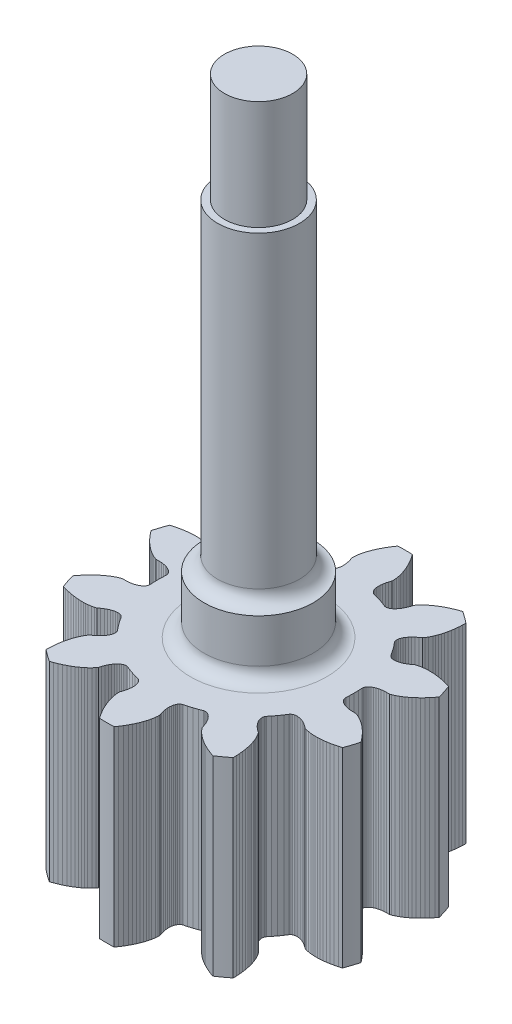
from build123d import *

# Parameters (mm, degrees)
SKETCH1_R           = 2
BOSS_EXTRUDE1_DEPTH = 2.1
SKETCH2_R           = 1.5
BOSS_EXTRUDE3_DEPTH = 15.8
BOSS_EXTRUDE4_DEPTH = 7
FILLET1_R           = 0.5
CUT_EXTRUDE3_START  = -4
SKETCH5_R           = 1.5
SKETCH5_R_2         = 1.25
CUT_EXTRUDE3_DEPTH  = 4


with BuildPart() as part:
    # Sketch1 → Boss-Extrude1 (new body)
    with BuildSketch(Plane(origin=(0, 0, 0), x_dir=(1, 0, 0), z_dir=(0, 1, 0))):
        with Locations(Location((0, 0, 0), (0, 0, 270))):
            Circle(SKETCH1_R)
    extrude(amount=BOSS_EXTRUDE1_DEPTH)

    # Sketch2 → Boss-Extrude3 (add)
    with BuildSketch(Plane(origin=(0, 2.1, 0), x_dir=(1, 0, 0), z_dir=(0, 1, 0))):
        with Locations(Location((0, 0, 0), (0, 0, 270))):
            Circle(SKETCH2_R)
    extrude(amount=BOSS_EXTRUDE3_DEPTH)

    # Sketch4 → Boss-Extrude4 (add)
    with BuildSketch(Plane.XZ):
        with BuildLine():
            Line((-3.502172386, -4.006520446), (-3.489098986, -3.880720446))
            Line((-3.489098986, -3.880720446), (-3.472014986, -3.764268346))
            Line((-3.472014986, -3.764268346), (-3.451540686, -3.656378846))
            Line((-3.451540686, -3.656378846), (-3.428181486, -3.556355946))
            Line((-3.428181486, -3.556355946), (-3.402988686, -3.465729946))
            Line((-3.402988686, -3.465729946), (-3.376065786, -3.382487046))
            Line((-3.376065786, -3.382487046), (-3.348306486, -3.307523846))
            Line((-3.348306486, -3.307523846), (-3.320181886, -3.240379146))
            Line((-3.320181886, -3.240379146), (-3.266407586, -3.131298946))
            Line((-3.266407586, -3.131298946), (-3.218278986, -3.051264446))
            Line((-3.218278986, -3.051264446), (-3.178117286, -2.996127846))
            Line((-3.178117286, -2.996127846), (-3.098559286, -2.941403346))
            Line((-3.098559286, -2.941403346), (-3.022652486, -2.880802746))
            Line((-3.022652486, -2.880802746), (-2.957019886, -2.819348146))
            Line((-2.957019886, -2.819348146), (-2.901592786, -2.757780546))
            Line((-2.901592786, -2.757780546), (-2.856248686, -2.696863946))
            Line((-2.856248686, -2.696863946), (-2.820830686, -2.637324746))
            Line((-2.820830686, -2.637324746), (-2.795113386, -2.579864646))
            Line((-2.795113386, -2.579864646), (-2.778873586, -2.525198846))
            Line((-2.778873586, -2.525198846), (-2.771797686, -2.474014346))
            Line((-2.771797686, -2.474014346), (-2.773561786, -2.426978146))
            Line((-2.773561786, -2.426978146), (-2.783801486, -2.384727846))
            Line((-2.783801486, -2.384727846), (-2.802098086, -2.347873846))
            Line((-2.802098086, -2.347873846), (-2.810946486, -2.335576046))
            Line((-2.810946486, -2.335576046), (-2.897380486, -2.230985746))
            Line((-2.897380486, -2.230985746), (-2.994333386, -2.103581146))
            Line((-2.994333386, -2.103581146), (-3.085542286, -1.972003246))
            Line((-3.085542286, -1.972003246), (-3.158303986, -1.857479346))
            Line((-3.158303986, -1.857479346), (-3.167265586, -1.845263946))
            Line((-3.167265586, -1.845263946), (-3.196661886, -1.816474346))
            Line((-3.196661886, -1.816474346), (-3.233680086, -1.793679646))
            Line((-3.233680086, -1.793679646), (-3.277869086, -1.777466946))
            Line((-3.277869086, -1.777466946), (-3.328734986, -1.768379646))
            Line((-3.328734986, -1.768379646), (-3.385743486, -1.766931946))
            Line((-3.385743486, -1.766931946), (-3.448338486, -1.773634446))
            Line((-3.448338486, -1.773634446), (-3.515908386, -1.788920346))
            Line((-3.515908386, -1.788920346), (-3.587855586, -1.813220846))
            Line((-3.587855586, -1.813220846), (-3.663537786, -1.846909746))
            Line((-3.663537786, -1.846909746), (-3.742266186, -1.890339446))
            Line((-3.742266186, -1.890339446), (-3.823357286, -1.943804546))
            Line((-3.823357286, -1.943804546), (-3.899988086, -2.002557846))
            Line((-3.899988086, -2.002557846), (-3.964836786, -2.023715746))
            Line((-3.964836786, -2.023715746), (-4.055826686, -2.044756746))
            Line((-4.055826686, -2.044756746), (-4.176185286, -2.062191546))
            Line((-4.176185286, -2.062191546), (-4.248734686, -2.068190746))
            Line((-4.248734686, -2.068190746), (-4.328607086, -2.071426546))
            Line((-4.328607086, -2.071426546), (-4.416095286, -2.071308246))
            Line((-4.416095286, -2.071308246), (-4.510070786, -2.067263046))
            Line((-4.510070786, -2.067263046), (-4.612416586, -2.058570246))
            Line((-4.612416586, -2.058570246), (-4.721352586, -2.044702746))
            Line((-4.721352586, -2.044702746), (-4.837384286, -2.024964946))
            Line((-4.837384286, -2.024964946), (-4.961067086, -1.998524146))
            Line((-4.961067086, -1.998524146), (-5.088285486, -1.965702846))
            Line((-5.088285486, -1.965702846), (-5.199859886, -1.932155946))
            ThreePointArc((-5.199859886, -1.932155946), (-5.288876117, -1.679412336), (-5.365419485, -1.422616047))
            Line((-5.365419485, -1.422616047), (-5.29487224, -1.329894231))
            Line((-5.29487224, -1.329894231), (-5.21124224, -1.228564231))
            Line((-5.21124224, -1.228564231), (-5.12672224, -1.134474231))
            Line((-5.12672224, -1.134474231), (-5.04445224, -1.050304231))
            Line((-5.04445224, -1.050304231), (-4.96447224, -0.975054231))
            Line((-4.96447224, -0.975054231), (-4.88678224, -0.907864231))
            Line((-4.88678224, -0.907864231), (-4.81313224, -0.849354231))
            Line((-4.81313224, -0.849354231), (-4.74242224, -0.797834231))
            Line((-4.74242224, -0.797834231), (-4.67590224, -0.753504231))
            Line((-4.67590224, -0.753504231), (-4.61368224, -0.715714231))
            Line((-4.61368224, -0.715714231), (-4.50606224, -0.659074231))
            Line((-4.50606224, -0.659074231), (-4.42008224, -0.622614231))
            Line((-4.42008224, -0.622614231), (-4.35518224, -0.601614231))
            Line((-4.35518224, -0.601614231), (-4.25865224, -0.604104231))
            Line((-4.25865224, -0.604104231), (-4.16162224, -0.599694231))
            Line((-4.16162224, -0.599694231), (-4.07240224, -0.588554231))
            Line((-4.07240224, -0.588554231), (-3.99137224, -0.571324231))
            Line((-3.99137224, -0.571324231), (-3.91888224, -0.548694231))
            Line((-3.91888224, -0.548694231), (-3.85523224, -0.521344231))
            Line((-3.85523224, -0.521344231), (-3.80065224, -0.489974231))
            Line((-3.80065224, -0.489974231), (-3.75538224, -0.455294231))
            Line((-3.75538224, -0.455294231), (-3.71957224, -0.418044231))
            Line((-3.71957224, -0.418044231), (-3.69335224, -0.378954231))
            Line((-3.69335224, -0.378954231), (-3.67680224, -0.338754231))
            Line((-3.67680224, -0.338754231), (-3.66994224, -0.298184231))
            Line((-3.66994224, -0.298184231), (-3.66987224, -0.283034231))
            Line((-3.66987224, -0.283034231), (-3.67832224, -0.147614231))
            Line((-3.67832224, -0.147614231), (-3.68187224, 0.012445769))
            Line((-3.68187224, 0.012445769), (-3.67832224, 0.172505769))
            Line((-3.67832224, 0.172505769), (-3.66987224, 0.307925769))
            Line((-3.66987224, 0.307925769), (-3.66994224, 0.323075769))
            Line((-3.66994224, 0.323075769), (-3.67680224, 0.363645769))
            Line((-3.67680224, 0.363645769), (-3.69335224, 0.403845769))
            Line((-3.69335224, 0.403845769), (-3.71957224, 0.442935769))
            Line((-3.71957224, 0.442935769), (-3.75538224, 0.480185769))
            Line((-3.75538224, 0.480185769), (-3.80065224, 0.514865769))
            Line((-3.80065224, 0.514865769), (-3.85523224, 0.546235769))
            Line((-3.85523224, 0.546235769), (-3.91888224, 0.573585769))
            Line((-3.91888224, 0.573585769), (-3.99137224, 0.596215769))
            Line((-3.99137224, 0.596215769), (-4.07240224, 0.613445769))
            Line((-4.07240224, 0.613445769), (-4.16162224, 0.624585769))
            Line((-4.16162224, 0.624585769), (-4.25865224, 0.628995769))
            Line((-4.25865224, 0.628995769), (-4.35518224, 0.626505769))
            Line((-4.35518224, 0.626505769), (-4.42008224, 0.647505769))
            Line((-4.42008224, 0.647505769), (-4.50606224, 0.683965769))
            Line((-4.50606224, 0.683965769), (-4.61368224, 0.740605769))
            Line((-4.61368224, 0.740605769), (-4.67590224, 0.778395769))
            Line((-4.67590224, 0.778395769), (-4.74242224, 0.822725769))
            Line((-4.74242224, 0.822725769), (-4.81313224, 0.874245769))
            Line((-4.81313224, 0.874245769), (-4.88678224, 0.932755769))
            Line((-4.88678224, 0.932755769), (-4.96447224, 0.999945769))
            Line((-4.96447224, 0.999945769), (-5.04445224, 1.075195769))
            Line((-5.04445224, 1.075195769), (-5.12672224, 1.159365769))
            Line((-5.12672224, 1.159365769), (-5.21124224, 1.253455769))
            Line((-5.21124224, 1.253455769), (-5.29487224, 1.354785769))
            Line((-5.29487224, 1.354785769), (-5.36541934, 1.447507569))
            ThreePointArc((-5.36541934, 1.447507569), (-5.288875971, 1.704303861), (-5.199859739, 1.957047474))
            Line((-5.199859739, 1.957047474), (-5.088285394, 1.990594354))
            Line((-5.088285394, 1.990594354), (-4.961066994, 2.023415654))
            Line((-4.961066994, 2.023415654), (-4.837384194, 2.049856454))
            Line((-4.837384194, 2.049856454), (-4.721352494, 2.069594254))
            Line((-4.721352494, 2.069594254), (-4.612416494, 2.083461754))
            Line((-4.612416494, 2.083461754), (-4.510070694, 2.092154554))
            Line((-4.510070694, 2.092154554), (-4.416095194, 2.096199754))
            Line((-4.416095194, 2.096199754), (-4.328606994, 2.096318054))
            Line((-4.328606994, 2.096318054), (-4.248734594, 2.093082254))
            Line((-4.248734594, 2.093082254), (-4.176185194, 2.087083054))
            Line((-4.176185194, 2.087083054), (-4.055826594, 2.069648254))
            Line((-4.055826594, 2.069648254), (-3.964836694, 2.048607254))
            Line((-3.964836694, 2.048607254), (-3.899987994, 2.027449354))
            Line((-3.899987994, 2.027449354), (-3.823357194, 1.968696054))
            Line((-3.823357194, 1.968696054), (-3.742266094, 1.915230954))
            Line((-3.742266094, 1.915230954), (-3.663537694, 1.871801254))
            Line((-3.663537694, 1.871801254), (-3.587855494, 1.838112354))
            Line((-3.587855494, 1.838112354), (-3.515908294, 1.813811854))
            Line((-3.515908294, 1.813811854), (-3.448338394, 1.798525954))
            Line((-3.448338394, 1.798525954), (-3.385743394, 1.791823454))
            Line((-3.385743394, 1.791823454), (-3.328734894, 1.793271154))
            Line((-3.328734894, 1.793271154), (-3.277868994, 1.802358454))
            Line((-3.277868994, 1.802358454), (-3.233679994, 1.818571154))
            Line((-3.233679994, 1.818571154), (-3.196661794, 1.841365854))
            Line((-3.196661794, 1.841365854), (-3.167265494, 1.870155454))
            Line((-3.167265494, 1.870155454), (-3.158303894, 1.882370854))
            Line((-3.158303894, 1.882370854), (-3.085542194, 1.996894754))
            Line((-3.085542194, 1.996894754), (-2.994333294, 2.128472654))
            Line((-2.994333294, 2.128472654), (-2.897380394, 2.255877254))
            Line((-2.897380394, 2.255877254), (-2.810946394, 2.360467554))
            Line((-2.810946394, 2.360467554), (-2.802097994, 2.372765354))
            Line((-2.802097994, 2.372765354), (-2.783801394, 2.409619354))
            Line((-2.783801394, 2.409619354), (-2.773561694, 2.451869654))
            Line((-2.773561694, 2.451869654), (-2.771797594, 2.498905854))
            Line((-2.771797594, 2.498905854), (-2.778873494, 2.550090354))
            Line((-2.778873494, 2.550090354), (-2.795113294, 2.604756154))
            Line((-2.795113294, 2.604756154), (-2.820830594, 2.662216254))
            Line((-2.820830594, 2.662216254), (-2.856248594, 2.721755454))
            Line((-2.856248594, 2.721755454), (-2.901592694, 2.782672054))
            Line((-2.901592694, 2.782672054), (-2.957019794, 2.844239654))
            Line((-2.957019794, 2.844239654), (-3.022652394, 2.905694254))
            Line((-3.022652394, 2.905694254), (-3.098559194, 2.966294854))
            Line((-3.098559194, 2.966294854), (-3.178117194, 3.021019354))
            Line((-3.178117194, 3.021019354), (-3.218278894, 3.076155954))
            Line((-3.218278894, 3.076155954), (-3.266407494, 3.156190454))
            Line((-3.266407494, 3.156190454), (-3.320181794, 3.265270654))
            Line((-3.320181794, 3.265270654), (-3.348306394, 3.332415354))
            Line((-3.348306394, 3.332415354), (-3.376065694, 3.407378554))
            Line((-3.376065694, 3.407378554), (-3.402988594, 3.490621454))
            Line((-3.402988594, 3.490621454), (-3.428181394, 3.581247454))
            Line((-3.428181394, 3.581247454), (-3.451540594, 3.681270354))
            Line((-3.451540594, 3.681270354), (-3.472014894, 3.789159854))
            Line((-3.472014894, 3.789159854), (-3.489098894, 3.905611954))
            Line((-3.489098894, 3.905611954), (-3.502172294, 4.031411954))
            Line((-3.502172294, 4.031411954), (-3.510270094, 4.162546154))
            Line((-3.510270094, 4.162546154), (-3.512843394, 4.279026254))
            ThreePointArc((-3.512843394, 4.279026254), (-3.299977421, 4.441787778), (-3.079402794, 4.593939248))
            Line((-3.079402794, 4.593939248), (-2.969419, 4.555497462))
            Line((-2.969419, 4.555497462), (-2.8472053, 4.507273362))
            Line((-2.8472053, 4.507273362), (-2.7316023, 4.455965462))
            Line((-2.7316023, 4.455965462), (-2.626129, 4.403731962))
            Line((-2.626129, 4.403731962), (-2.5298468, 4.350920062))
            Line((-2.5298468, 4.350920062), (-2.4419378, 4.297795262))
            Line((-2.4419378, 4.297795262), (-2.3635324, 4.245830562))
            Line((-2.3635324, 4.245830562), (-2.2926834, 4.194501962))
            Line((-2.2926834, 4.194501962), (-2.2299672, 4.144936362))
            Line((-2.2299672, 4.144936362), (-2.1747998, 4.097439362))
            Line((-2.1747998, 4.097439362), (-2.0876755, 4.012589362))
            Line((-2.0876755, 4.012589362), (-2.0264307, 3.942084362))
            Line((-2.0264307, 3.942084362), (-1.9864033, 3.886850062))
            Line((-1.9864033, 3.886850062), (-1.9589421, 3.794275162))
            Line((-1.9589421, 3.794275162), (-1.924764, 3.703356962))
            Line((-1.924764, 3.703356962), (-1.8865987, 3.621946062))
            Line((-1.8865987, 3.621946062), (-1.8451724, 3.550206362))
            Line((-1.8451724, 3.550206362), (-1.8012493, 3.488257362))
            Line((-1.8012493, 3.488257362), (-1.755569, 3.436174162))
            Line((-1.755569, 3.436174162), (-1.7088682, 3.393959362))
            Line((-1.7088682, 3.393959362), (-1.6618964, 3.361621762))
            Line((-1.6618964, 3.361621762), (-1.6154036, 3.339075362))
            Line((-1.6154036, 3.339075362), (-1.5701244, 3.326218062))
            Line((-1.5701244, 3.326218062), (-1.5267777, 3.322900562))
            Line((-1.5267777, 3.322900562), (-1.4860735, 3.328913162))
            Line((-1.4860735, 3.328913162), (-1.4716433, 3.333528162))
            Line((-1.4716433, 3.333528162), (-1.3454624, 3.383411662))
            Line((-1.3454624, 3.383411662), (-1.1943333, 3.436249262))
            Line((-1.1943333, 3.436249262), (-1.0410102, 3.482334262))
            Line((-1.0410102, 3.482334262), (-0.909607, 3.516144862))
            Line((-0.909607, 3.516144862), (-0.8952201, 3.520893062))
            Line((-0.8952201, 3.520893062), (-0.8587556, 3.539954162))
            Line((-0.8587556, 3.539954162), (-0.8256373, 3.568116562))
            Line((-0.8256373, 3.568116562), (-0.796563, 3.605132762))
            Line((-0.796563, 3.605132762), (-0.772202, 3.650700962))
            Line((-0.772202, 3.650700962), (-0.7532086, 3.704472062))
            Line((-0.7532086, 3.704472062), (-0.7402401, 3.766074562))
            Line((-0.7402401, 3.766074562), (-0.7338976, 3.835060962))
            Line((-0.7338976, 3.835060962), (-0.7347758, 3.910996062))
            Line((-0.7347758, 3.910996062), (-0.7434288, 3.993384562))
            Line((-0.7434288, 3.993384562), (-0.7604045, 4.081680262))
            Line((-0.7604045, 4.081680262), (-0.7861943, 4.175324062))
            Line((-0.7861943, 4.175324062), (-0.8183918, 4.266360062))
            Line((-0.8183918, 4.266360062), (-0.8184748, 4.334572962))
            Line((-0.8184748, 4.334572962), (-0.8103686, 4.427611562))
            Line((-0.8103686, 4.427611562), (-0.7897572, 4.547466962))
            Line((-0.7897572, 4.547466962), (-0.7730438, 4.618319462))
            Line((-0.7730438, 4.618319462), (-0.7514392, 4.695282462))
            Line((-0.7514392, 4.695282462), (-0.7242914, 4.778452262))
            Line((-0.7242914, 4.778452262), (-0.6914042, 4.866578162))
            Line((-0.6914042, 4.866578162), (-0.6515102, 4.961228562))
            Line((-0.6515102, 4.961228562), (-0.6046584, 5.060547662))
            Line((-0.6046584, 5.060547662), (-0.5500308, 5.164800962))
            Line((-0.5500308, 5.164800962), (-0.486664, 5.274259662))
            Line((-0.486664, 5.274259662), (-0.4161366, 5.385109262))
            Line((-0.4161366, 5.385109262), (-0.3497532, 5.480856162))
            ThreePointArc((-0.3497532, 5.480856162), (-0.081872201, 5.487413535), (0.186008797, 5.480856162))
            Line((0.186008797, 5.480856162), (0.2523922, 5.385109235))
            Line((0.2523922, 5.385109235), (0.3229197, 5.274259635))
            Line((0.3229197, 5.274259635), (0.3862865, 5.164800935))
            Line((0.3862865, 5.164800935), (0.4409141, 5.060547635))
            Line((0.4409141, 5.060547635), (0.4877659, 4.961228535))
            Line((0.4877659, 4.961228535), (0.5276599, 4.866578135))
            Line((0.5276599, 4.866578135), (0.5605471, 4.778452235))
            Line((0.5605471, 4.778452235), (0.5876949, 4.695282435))
            Line((0.5876949, 4.695282435), (0.6092994, 4.618319435))
            Line((0.6092994, 4.618319435), (0.6260128, 4.547466935))
            Line((0.6260128, 4.547466935), (0.6466243, 4.427611535))
            Line((0.6466243, 4.427611535), (0.6547305, 4.334572935))
            Line((0.6547305, 4.334572935), (0.6546475, 4.266360035))
            Line((0.6546475, 4.266360035), (0.6224499, 4.175324035))
            Line((0.6224499, 4.175324035), (0.5966602, 4.081680235))
            Line((0.5966602, 4.081680235), (0.5796845, 3.993384535))
            Line((0.5796845, 3.993384535), (0.5710315, 3.910996035))
            Line((0.5710315, 3.910996035), (0.5701533, 3.835060935))
            Line((0.5701533, 3.835060935), (0.5764957, 3.766074535))
            Line((0.5764957, 3.766074535), (0.5894642, 3.704472035))
            Line((0.5894642, 3.704472035), (0.6084577, 3.650700935))
            Line((0.6084577, 3.650700935), (0.6328186, 3.605132735))
            Line((0.6328186, 3.605132735), (0.661893, 3.568116535))
            Line((0.661893, 3.568116535), (0.6950113, 3.539954135))
            Line((0.6950113, 3.539954135), (0.7314758, 3.520893035))
            Line((0.7314758, 3.520893035), (0.7458626, 3.516144835))
            Line((0.7458626, 3.516144835), (0.8772659, 3.482334235))
            Line((0.8772659, 3.482334235), (1.030589, 3.436249235))
            Line((1.030589, 3.436249235), (1.1817181, 3.383411635))
            Line((1.1817181, 3.383411635), (1.307899, 3.333528135))
            Line((1.307899, 3.333528135), (1.3223291, 3.328913135))
            Line((1.3223291, 3.328913135), (1.3630333, 3.322900535))
            Line((1.3630333, 3.322900535), (1.4063801, 3.326218035))
            Line((1.4063801, 3.326218035), (1.4516593, 3.339075335))
            Line((1.4516593, 3.339075335), (1.498152, 3.361621735))
            Line((1.498152, 3.361621735), (1.5451239, 3.393959335))
            Line((1.5451239, 3.393959335), (1.5918247, 3.436174135))
            Line((1.5918247, 3.436174135), (1.637505, 3.488257335))
            Line((1.637505, 3.488257335), (1.681428, 3.550206335))
            Line((1.681428, 3.550206335), (1.7228544, 3.621946035))
            Line((1.7228544, 3.621946035), (1.7610197, 3.703356935))
            Line((1.7610197, 3.703356935), (1.7951977, 3.794275135))
            Line((1.7951977, 3.794275135), (1.822659, 3.886850035))
            Line((1.822659, 3.886850035), (1.8626864, 3.942084335))
            Line((1.8626864, 3.942084335), (1.9239312, 4.012589335))
            Line((1.9239312, 4.012589335), (2.0110555, 4.097439335))
            Line((2.0110555, 4.097439335), (2.0662229, 4.144936335))
            Line((2.0662229, 4.144936335), (2.1289391, 4.194501935))
            Line((2.1289391, 4.194501935), (2.1997881, 4.245830535))
            Line((2.1997881, 4.245830535), (2.2781935, 4.297795235))
            Line((2.2781935, 4.297795235), (2.3661025, 4.350920035))
            Line((2.3661025, 4.350920035), (2.4623847, 4.403731935))
            Line((2.4623847, 4.403731935), (2.567858, 4.455965435))
            Line((2.567858, 4.455965435), (2.683461, 4.507273335))
            Line((2.683461, 4.507273335), (2.8056746, 4.555497435))
            Line((2.8056746, 4.555497435), (2.9156586, 4.593939235))
            ThreePointArc((2.9156586, 4.593939235), (3.136233228, 4.441787764), (3.349099202, 4.279026239))
            Line((3.349099202, 4.279026239), (3.346525809, 4.162546147))
            Line((3.346525809, 4.162546147), (3.338428009, 4.031411947))
            Line((3.338428009, 4.031411947), (3.325354609, 3.905611947))
            Line((3.325354609, 3.905611947), (3.308270609, 3.789159847))
            Line((3.308270609, 3.789159847), (3.287796309, 3.681270347))
            Line((3.287796309, 3.681270347), (3.264437009, 3.581247447))
            Line((3.264437009, 3.581247447), (3.239244309, 3.490621447))
            Line((3.239244309, 3.490621447), (3.212321409, 3.407378547))
            Line((3.212321409, 3.407378547), (3.184562109, 3.332415347))
            Line((3.184562109, 3.332415347), (3.156437409, 3.265270647))
            Line((3.156437409, 3.265270647), (3.102663209, 3.156190447))
            Line((3.102663209, 3.156190447), (3.054534509, 3.076155947))
            Line((3.054534509, 3.076155947), (3.014372809, 3.021019347))
            Line((3.014372809, 3.021019347), (2.934814809, 2.966294847))
            Line((2.934814809, 2.966294847), (2.858908109, 2.905694247))
            Line((2.858908109, 2.905694247), (2.793275509, 2.844239647))
            Line((2.793275509, 2.844239647), (2.737848409, 2.782672047))
            Line((2.737848409, 2.782672047), (2.692504309, 2.721755447))
            Line((2.692504309, 2.721755447), (2.657086309, 2.662216247))
            Line((2.657086309, 2.662216247), (2.631369009, 2.604756147))
            Line((2.631369009, 2.604756147), (2.615129209, 2.550090347))
            Line((2.615129209, 2.550090347), (2.608053309, 2.498905847))
            Line((2.608053309, 2.498905847), (2.609817409, 2.451869647))
            Line((2.609817409, 2.451869647), (2.620057109, 2.409619347))
            Line((2.620057109, 2.409619347), (2.638353709, 2.372765347))
            Line((2.638353709, 2.372765347), (2.647202009, 2.360467547))
            Line((2.647202009, 2.360467547), (2.733636109, 2.255877247))
            Line((2.733636109, 2.255877247), (2.830589009, 2.128472647))
            Line((2.830589009, 2.128472647), (2.921797909, 1.996894747))
            Line((2.921797909, 1.996894747), (2.994559609, 1.882370847))
            Line((2.994559609, 1.882370847), (3.003521209, 1.870155447))
            Line((3.003521209, 1.870155447), (3.032917509, 1.841365847))
            Line((3.032917509, 1.841365847), (3.069935709, 1.818571147))
            Line((3.069935709, 1.818571147), (3.114124609, 1.802358447))
            Line((3.114124609, 1.802358447), (3.164990509, 1.793271147))
            Line((3.164990509, 1.793271147), (3.221999109, 1.791823447))
            Line((3.221999109, 1.791823447), (3.284594109, 1.798525947))
            Line((3.284594109, 1.798525947), (3.352164009, 1.813811847))
            Line((3.352164009, 1.813811847), (3.424111209, 1.838112347))
            Line((3.424111209, 1.838112347), (3.499793409, 1.871801247))
            Line((3.499793409, 1.871801247), (3.578521809, 1.915230947))
            Line((3.578521809, 1.915230947), (3.659612809, 1.968696047))
            Line((3.659612809, 1.968696047), (3.736243709, 2.027449347))
            Line((3.736243709, 2.027449347), (3.801092409, 2.048607247))
            Line((3.801092409, 2.048607247), (3.892082309, 2.069648247))
            Line((3.892082309, 2.069648247), (4.012440909, 2.087083047))
            Line((4.012440909, 2.087083047), (4.084990309, 2.093082247))
            Line((4.084990309, 2.093082247), (4.164862609, 2.096318047))
            Line((4.164862609, 2.096318047), (4.252350909, 2.096199747))
            Line((4.252350909, 2.096199747), (4.346326309, 2.092154547))
            Line((4.346326309, 2.092154547), (4.448672209, 2.083461747))
            Line((4.448672209, 2.083461747), (4.557608209, 2.069594247))
            Line((4.557608209, 2.069594247), (4.673639909, 2.049856447))
            Line((4.673639909, 2.049856447), (4.797322709, 2.023415647))
            Line((4.797322709, 2.023415647), (4.924541109, 1.990594347))
            Line((4.924541109, 1.990594347), (5.036115409, 1.957047447))
            ThreePointArc((5.036115409, 1.957047447), (5.125131639, 1.704303837), (5.201675008, 1.447507548))
            Line((5.201675008, 1.447507548), (5.131127762, 1.354785732))
            Line((5.131127762, 1.354785732), (5.047497762, 1.253455732))
            Line((5.047497762, 1.253455732), (4.962977762, 1.159365732))
            Line((4.962977762, 1.159365732), (4.880707762, 1.075195732))
            Line((4.880707762, 1.075195732), (4.800727762, 0.999945732))
            Line((4.800727762, 0.999945732), (4.723037762, 0.932755732))
            Line((4.723037762, 0.932755732), (4.649387762, 0.874245732))
            Line((4.649387762, 0.874245732), (4.578677762, 0.822725732))
            Line((4.578677762, 0.822725732), (4.512157762, 0.778395732))
            Line((4.512157762, 0.778395732), (4.449937762, 0.740605732))
            Line((4.449937762, 0.740605732), (4.342317762, 0.683965732))
            Line((4.342317762, 0.683965732), (4.256337762, 0.647505732))
            Line((4.256337762, 0.647505732), (4.191437762, 0.626505732))
            Line((4.191437762, 0.626505732), (4.094907762, 0.628995732))
            Line((4.094907762, 0.628995732), (3.997877762, 0.624585732))
            Line((3.997877762, 0.624585732), (3.908657762, 0.613445732))
            Line((3.908657762, 0.613445732), (3.827627762, 0.596215732))
            Line((3.827627762, 0.596215732), (3.755137762, 0.573585732))
            Line((3.755137762, 0.573585732), (3.691487762, 0.546235732))
            Line((3.691487762, 0.546235732), (3.636907762, 0.514865732))
            Line((3.636907762, 0.514865732), (3.591637762, 0.480185732))
            Line((3.591637762, 0.480185732), (3.555827762, 0.442935732))
            Line((3.555827762, 0.442935732), (3.529607762, 0.403845732))
            Line((3.529607762, 0.403845732), (3.513057762, 0.363645732))
            Line((3.513057762, 0.363645732), (3.506197762, 0.323075732))
            Line((3.506197762, 0.323075732), (3.506127762, 0.307925732))
            Line((3.506127762, 0.307925732), (3.514577762, 0.172505732))
            Line((3.514577762, 0.172505732), (3.518127762, 0.012445732))
            Line((3.518127762, 0.012445732), (3.514577762, -0.147614268))
            Line((3.514577762, -0.147614268), (3.506127762, -0.283034268))
            Line((3.506127762, -0.283034268), (3.506197762, -0.298184268))
            Line((3.506197762, -0.298184268), (3.513057762, -0.338754268))
            Line((3.513057762, -0.338754268), (3.529607762, -0.378954268))
            Line((3.529607762, -0.378954268), (3.555827762, -0.418044268))
            Line((3.555827762, -0.418044268), (3.591637762, -0.455294268))
            Line((3.591637762, -0.455294268), (3.636907762, -0.489974268))
            Line((3.636907762, -0.489974268), (3.691487762, -0.521344268))
            Line((3.691487762, -0.521344268), (3.755137762, -0.548694268))
            Line((3.755137762, -0.548694268), (3.827627762, -0.571324268))
            Line((3.827627762, -0.571324268), (3.908657762, -0.588554268))
            Line((3.908657762, -0.588554268), (3.997877762, -0.599694268))
            Line((3.997877762, -0.599694268), (4.094907762, -0.604104268))
            Line((4.094907762, -0.604104268), (4.191437762, -0.601614268))
            Line((4.191437762, -0.601614268), (4.256337762, -0.622614268))
            Line((4.256337762, -0.622614268), (4.342317762, -0.659074268))
            Line((4.342317762, -0.659074268), (4.449937762, -0.715714268))
            Line((4.449937762, -0.715714268), (4.512157762, -0.753504268))
            Line((4.512157762, -0.753504268), (4.578677762, -0.797834268))
            Line((4.578677762, -0.797834268), (4.649387762, -0.849354268))
            Line((4.649387762, -0.849354268), (4.723037762, -0.907864268))
            Line((4.723037762, -0.907864268), (4.800727762, -0.975054268))
            Line((4.800727762, -0.975054268), (4.880707762, -1.050304268))
            Line((4.880707762, -1.050304268), (4.962977762, -1.134474268))
            Line((4.962977762, -1.134474268), (5.047497762, -1.228564268))
            Line((5.047497762, -1.228564268), (5.131127762, -1.329894268))
            Line((5.131127762, -1.329894268), (5.201674962, -1.422616068))
            ThreePointArc((5.201674962, -1.422616068), (5.125131593, -1.67941236), (5.036115361, -1.932155973))
            Line((5.036115361, -1.932155973), (4.924541017, -1.965702853))
            Line((4.924541017, -1.965702853), (4.797322617, -1.998524153))
            Line((4.797322617, -1.998524153), (4.673639817, -2.024964953))
            Line((4.673639817, -2.024964953), (4.557608117, -2.044702753))
            Line((4.557608117, -2.044702753), (4.448672117, -2.058570253))
            Line((4.448672117, -2.058570253), (4.346326217, -2.067263053))
            Line((4.346326217, -2.067263053), (4.252350817, -2.071308253))
            Line((4.252350817, -2.071308253), (4.164862517, -2.071426553))
            Line((4.164862517, -2.071426553), (4.084990217, -2.068190753))
            Line((4.084990217, -2.068190753), (4.012440817, -2.062191553))
            Line((4.012440817, -2.062191553), (3.892082217, -2.044756753))
            Line((3.892082217, -2.044756753), (3.801092317, -2.023715753))
            Line((3.801092317, -2.023715753), (3.736243617, -2.002557853))
            Line((3.736243617, -2.002557853), (3.659612717, -1.943804553))
            Line((3.659612717, -1.943804553), (3.578521717, -1.890339453))
            Line((3.578521717, -1.890339453), (3.499793317, -1.846909753))
            Line((3.499793317, -1.846909753), (3.424111117, -1.813220853))
            Line((3.424111117, -1.813220853), (3.352163917, -1.788920353))
            Line((3.352163917, -1.788920353), (3.284594017, -1.773634453))
            Line((3.284594017, -1.773634453), (3.221999017, -1.766931953))
            Line((3.221999017, -1.766931953), (3.164990417, -1.768379653))
            Line((3.164990417, -1.768379653), (3.114124517, -1.777466953))
            Line((3.114124517, -1.777466953), (3.069935617, -1.793679653))
            Line((3.069935617, -1.793679653), (3.032917417, -1.816474353))
            Line((3.032917417, -1.816474353), (3.003521117, -1.845263953))
            Line((3.003521117, -1.845263953), (2.994559517, -1.857479353))
            Line((2.994559517, -1.857479353), (2.921797817, -1.972003253))
            Line((2.921797817, -1.972003253), (2.830588917, -2.103581153))
            Line((2.830588917, -2.103581153), (2.733636017, -2.230985753))
            Line((2.733636017, -2.230985753), (2.647201917, -2.335576053))
            Line((2.647201917, -2.335576053), (2.638353617, -2.347873853))
            Line((2.638353617, -2.347873853), (2.620057017, -2.384727853))
            Line((2.620057017, -2.384727853), (2.609817317, -2.426978153))
            Line((2.609817317, -2.426978153), (2.608053217, -2.474014353))
            Line((2.608053217, -2.474014353), (2.615129117, -2.525198853))
            Line((2.615129117, -2.525198853), (2.631368917, -2.579864653))
            Line((2.631368917, -2.579864653), (2.657086217, -2.637324753))
            Line((2.657086217, -2.637324753), (2.692504217, -2.696863953))
            Line((2.692504217, -2.696863953), (2.737848317, -2.757780553))
            Line((2.737848317, -2.757780553), (2.793275417, -2.819348153))
            Line((2.793275417, -2.819348153), (2.858908017, -2.880802753))
            Line((2.858908017, -2.880802753), (2.934814717, -2.941403353))
            Line((2.934814717, -2.941403353), (3.014372717, -2.996127853))
            Line((3.014372717, -2.996127853), (3.054534417, -3.051264453))
            Line((3.054534417, -3.051264453), (3.102663117, -3.131298953))
            Line((3.102663117, -3.131298953), (3.156437317, -3.240379153))
            Line((3.156437317, -3.240379153), (3.184562017, -3.307523853))
            Line((3.184562017, -3.307523853), (3.212321317, -3.382487053))
            Line((3.212321317, -3.382487053), (3.239244217, -3.465729953))
            Line((3.239244217, -3.465729953), (3.264436917, -3.556355953))
            Line((3.264436917, -3.556355953), (3.287796217, -3.656378853))
            Line((3.287796217, -3.656378853), (3.308270517, -3.764268353))
            Line((3.308270517, -3.764268353), (3.325354517, -3.880720453))
            Line((3.325354517, -3.880720453), (3.338427917, -4.006520453))
            Line((3.338427917, -4.006520453), (3.346525717, -4.137654653))
            Line((3.346525717, -4.137654653), (3.349099017, -4.254134753))
            ThreePointArc((3.349099017, -4.254134753), (3.136233044, -4.416896277), (2.915658417, -4.569047747))
            Line((2.915658417, -4.569047747), (2.805674523, -4.530605961))
            Line((2.805674523, -4.530605961), (2.683460923, -4.482381861))
            Line((2.683460923, -4.482381861), (2.567857923, -4.431073961))
            Line((2.567857923, -4.431073961), (2.462384623, -4.378840461))
            Line((2.462384623, -4.378840461), (2.366102423, -4.326028561))
            Line((2.366102423, -4.326028561), (2.278193423, -4.272903761))
            Line((2.278193423, -4.272903761), (2.199788023, -4.220939061))
            Line((2.199788023, -4.220939061), (2.128939023, -4.169610461))
            Line((2.128939023, -4.169610461), (2.066222823, -4.120044861))
            Line((2.066222823, -4.120044861), (2.011055423, -4.072547861))
            Line((2.011055423, -4.072547861), (1.923931123, -3.987697861))
            Line((1.923931123, -3.987697861), (1.862686323, -3.917192861))
            Line((1.862686323, -3.917192861), (1.822658923, -3.861958561))
            Line((1.822658923, -3.861958561), (1.795197623, -3.769383661))
            Line((1.795197623, -3.769383661), (1.761019623, -3.678465461))
            Line((1.761019623, -3.678465461), (1.722854323, -3.597054561))
            Line((1.722854323, -3.597054561), (1.681427923, -3.525314861))
            Line((1.681427923, -3.525314861), (1.637504923, -3.463365861))
            Line((1.637504923, -3.463365861), (1.591824623, -3.411282661))
            Line((1.591824623, -3.411282661), (1.545123823, -3.369067861))
            Line((1.545123823, -3.369067861), (1.498151923, -3.336730261))
            Line((1.498151923, -3.336730261), (1.451659223, -3.314183861))
            Line((1.451659223, -3.314183861), (1.406380023, -3.301326561))
            Line((1.406380023, -3.301326561), (1.363033223, -3.298009061))
            Line((1.363033223, -3.298009061), (1.322329023, -3.304021661))
            Line((1.322329023, -3.304021661), (1.307898923, -3.308636661))
            Line((1.307898923, -3.308636661), (1.181718023, -3.358520161))
            Line((1.181718023, -3.358520161), (1.030588923, -3.411357761))
            Line((1.030588923, -3.411357761), (0.877265823, -3.457442761))
            Line((0.877265823, -3.457442761), (0.745862523, -3.491253361))
            Line((0.745862523, -3.491253361), (0.731475723, -3.496001561))
            Line((0.731475723, -3.496001561), (0.695011223, -3.515062661))
            Line((0.695011223, -3.515062661), (0.661892923, -3.543225061))
            Line((0.661892923, -3.543225061), (0.632818523, -3.580241261))
            Line((0.632818523, -3.580241261), (0.608457623, -3.625809461))
            Line((0.608457623, -3.625809461), (0.589464123, -3.679580561))
            Line((0.589464123, -3.679580561), (0.576495623, -3.741183061))
            Line((0.576495623, -3.741183061), (0.570153223, -3.810169461))
            Line((0.570153223, -3.810169461), (0.571031423, -3.886104561))
            Line((0.571031423, -3.886104561), (0.579684423, -3.968493061))
            Line((0.579684423, -3.968493061), (0.596660123, -4.056788761))
            Line((0.596660123, -4.056788761), (0.622449823, -4.150432561))
            Line((0.622449823, -4.150432561), (0.654647423, -4.241468561))
            Line((0.654647423, -4.241468561), (0.654730423, -4.309681461))
            Line((0.654730423, -4.309681461), (0.646624223, -4.402720061))
            Line((0.646624223, -4.402720061), (0.626012723, -4.522575461))
            Line((0.626012723, -4.522575461), (0.609299323, -4.593427961))
            Line((0.609299323, -4.593427961), (0.587694823, -4.670390961))
            Line((0.587694823, -4.670390961), (0.560547023, -4.753560761))
            Line((0.560547023, -4.753560761), (0.527659823, -4.841686661))
            Line((0.527659823, -4.841686661), (0.487765823, -4.936337061))
            Line((0.487765823, -4.936337061), (0.440914023, -5.035656161))
            Line((0.440914023, -5.035656161), (0.386286423, -5.139909461))
            Line((0.386286423, -5.139909461), (0.322919623, -5.249368161))
            Line((0.322919623, -5.249368161), (0.252392123, -5.360217761))
            Line((0.252392123, -5.360217761), (0.186008723, -5.455964661))
            ThreePointArc((0.186008723, -5.455964661), (-0.081872276, -5.462522034), (-0.349753275, -5.455964661))
            Line((-0.349753275, -5.455964661), (-0.416136677, -5.360217734))
            Line((-0.416136677, -5.360217734), (-0.486664077, -5.249368134))
            Line((-0.486664077, -5.249368134), (-0.550030877, -5.139909434))
            Line((-0.550030877, -5.139909434), (-0.604658477, -5.035656134))
            Line((-0.604658477, -5.035656134), (-0.651510277, -4.936337034))
            Line((-0.651510277, -4.936337034), (-0.691404277, -4.841686634))
            Line((-0.691404277, -4.841686634), (-0.724291477, -4.753560734))
            Line((-0.724291477, -4.753560734), (-0.751439277, -4.670390934))
            Line((-0.751439277, -4.670390934), (-0.773043877, -4.593427934))
            Line((-0.773043877, -4.593427934), (-0.789757277, -4.522575434))
            Line((-0.789757277, -4.522575434), (-0.810368677, -4.402720034))
            Line((-0.810368677, -4.402720034), (-0.818474877, -4.309681434))
            Line((-0.818474877, -4.309681434), (-0.818391877, -4.241468534))
            Line((-0.818391877, -4.241468534), (-0.786194377, -4.150432534))
            Line((-0.786194377, -4.150432534), (-0.760404577, -4.056788734))
            Line((-0.760404577, -4.056788734), (-0.743428877, -3.968493034))
            Line((-0.743428877, -3.968493034), (-0.734775877, -3.886104534))
            Line((-0.734775877, -3.886104534), (-0.733897677, -3.810169434))
            Line((-0.733897677, -3.810169434), (-0.740240177, -3.741183034))
            Line((-0.740240177, -3.741183034), (-0.753208677, -3.679580534))
            Line((-0.753208677, -3.679580534), (-0.772202077, -3.625809434))
            Line((-0.772202077, -3.625809434), (-0.796563077, -3.580241234))
            Line((-0.796563077, -3.580241234), (-0.825637377, -3.543225034))
            Line((-0.825637377, -3.543225034), (-0.858755677, -3.515062634))
            Line((-0.858755677, -3.515062634), (-0.895220177, -3.496001534))
            Line((-0.895220177, -3.496001534), (-0.909607077, -3.491253334))
            Line((-0.909607077, -3.491253334), (-1.041010277, -3.457442734))
            Line((-1.041010277, -3.457442734), (-1.194333377, -3.411357734))
            Line((-1.194333377, -3.411357734), (-1.345462477, -3.358520134))
            Line((-1.345462477, -3.358520134), (-1.471643377, -3.308636634))
            Line((-1.471643377, -3.308636634), (-1.486073577, -3.304021634))
            Line((-1.486073577, -3.304021634), (-1.526777777, -3.298009034))
            Line((-1.526777777, -3.298009034), (-1.570124477, -3.301326534))
            Line((-1.570124477, -3.301326534), (-1.615403677, -3.314183834))
            Line((-1.615403677, -3.314183834), (-1.661896477, -3.336730234))
            Line((-1.661896477, -3.336730234), (-1.708868277, -3.369067834))
            Line((-1.708868277, -3.369067834), (-1.755569077, -3.411282634))
            Line((-1.755569077, -3.411282634), (-1.801249377, -3.463365834))
            Line((-1.801249377, -3.463365834), (-1.845172477, -3.525314834))
            Line((-1.845172477, -3.525314834), (-1.886598777, -3.597054534))
            Line((-1.886598777, -3.597054534), (-1.924764077, -3.678465434))
            Line((-1.924764077, -3.678465434), (-1.958942177, -3.769383634))
            Line((-1.958942177, -3.769383634), (-1.986403377, -3.861958534))
            Line((-1.986403377, -3.861958534), (-2.026430777, -3.917192834))
            Line((-2.026430777, -3.917192834), (-2.087675577, -3.987697834))
            Line((-2.087675577, -3.987697834), (-2.174799877, -4.072547834))
            Line((-2.174799877, -4.072547834), (-2.229967277, -4.120044834))
            Line((-2.229967277, -4.120044834), (-2.292683477, -4.169610434))
            Line((-2.292683477, -4.169610434), (-2.363532477, -4.220939034))
            Line((-2.363532477, -4.220939034), (-2.441937877, -4.272903734))
            Line((-2.441937877, -4.272903734), (-2.529846877, -4.326028534))
            Line((-2.529846877, -4.326028534), (-2.626129077, -4.378840434))
            Line((-2.626129077, -4.378840434), (-2.731602377, -4.431073934))
            Line((-2.731602377, -4.431073934), (-2.847205377, -4.482381834))
            Line((-2.847205377, -4.482381834), (-2.969419077, -4.530605934))
            Line((-2.969419077, -4.530605934), (-3.079402977, -4.569047734))
            ThreePointArc((-3.079402977, -4.569047734), (-3.299977605, -4.416896263), (-3.512843579, -4.254134738))
            Line((-3.512843579, -4.254134738), (-3.510270186, -4.137654646))
            Line((-3.510270186, -4.137654646), (-3.502172386, -4.006520446))
        make_face()
    extrude(amount=BOSS_EXTRUDE4_DEPTH)

    # Fillet1
    fillet1_edges = [part.edges().sort_by_distance(p)[0] for p in [
        (0, 0, -2),
        (0, 2.1, -1.5),
    ]]
    fillet(fillet1_edges, radius=FILLET1_R - 0.0001)  # a hair under: the kernel refuses the full size

    # Sketch5 → Cut-Extrude3 (cut)
    with BuildSketch(Plane(origin=(0, 17.9, 0), x_dir=(1, 0, 0), z_dir=(0, 1, 0)).offset(CUT_EXTRUDE3_START)):
        with Locations(Location((0, 0, 0), (0, 0, 270))):
            Circle(SKETCH5_R)
        with Locations(Location((0, 0, 0), (0, 0, 270))):
            Circle(SKETCH5_R_2, mode=Mode.SUBTRACT)
    extrude(amount=CUT_EXTRUDE3_DEPTH, mode=Mode.SUBTRACT)


solid = part.part
